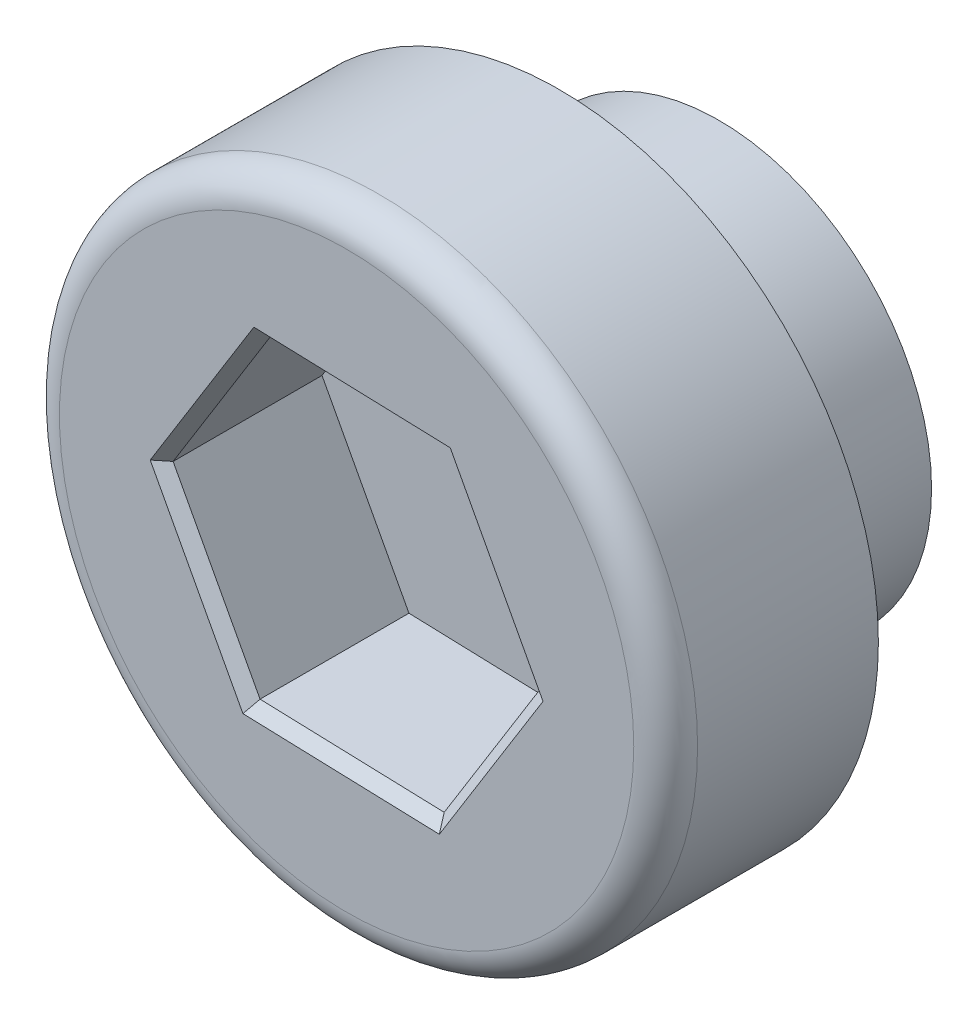
from build123d import *

# Parameters (mm, degrees)
SZKIC1_R                    = 4
DODANIE_WYCI_GNI_CIE1_DEPTH = 3
SZKIC2_R                    = 6
DODANIE_WYCI_GNI_CIE2_DEPTH = 4
WYTNIJ_WYCI_GNI_CIE1_DEPTH  = 3
ZAOKR_GLENIE1_R             = 0.6
SFAZOWANIE1_SIZE            = 0.2


with BuildPart() as part:
    # Szkic1 → Dodanie-wyciągnięcie1 (new body)
    with BuildSketch(Plane.XY):
        Circle(SZKIC1_R)
    extrude(amount=DODANIE_WYCI_GNI_CIE1_DEPTH)

    # Szkic2 → Dodanie-wyciągnięcie2 (add)
    with BuildSketch(Plane.XY.offset(3)):
        Circle(SZKIC2_R)
    extrude(amount=DODANIE_WYCI_GNI_CIE2_DEPTH)

    # Szkic3 → Wytnij-wyciągnięcie1 (cut)
    with BuildSketch(Plane.XY.offset(7)):
        Polygon((-1.634875161, 3.054043747), (-3.46231705, 0.111178452), (-1.827441888, -2.942865295), (1.634875161, -3.054043747), (3.46231705, -0.111178452), (1.827441888, 2.942865295), align=None)
    extrude(amount=-WYTNIJ_WYCI_GNI_CIE1_DEPTH, mode=Mode.SUBTRACT)

    # Zaokrąglenie1
    zaokr_glenie1_edges = [part.edges().sort_by_distance(p)[0] for p in [
        (-6, 0, 7),
    ]]
    fillet(zaokr_glenie1_edges, radius=ZAOKR_GLENIE1_R)

    # Sfazowanie1
    sfazowanie1_edges = [part.edges().sort_by_distance(p)[0] for p in [
        (-0.096283363, -2.998454521, 7),
        (-2.644879469, -1.415843422, 7),
        (-2.548596105, 1.582611099, 7),
        (0.096283363, 2.998454521, 7),
        (2.644879469, 1.415843422, 7),
        (2.548596105, -1.582611099, 7),
    ]]
    chamfer(sfazowanie1_edges, length=SFAZOWANIE1_SIZE)


solid = part.part
